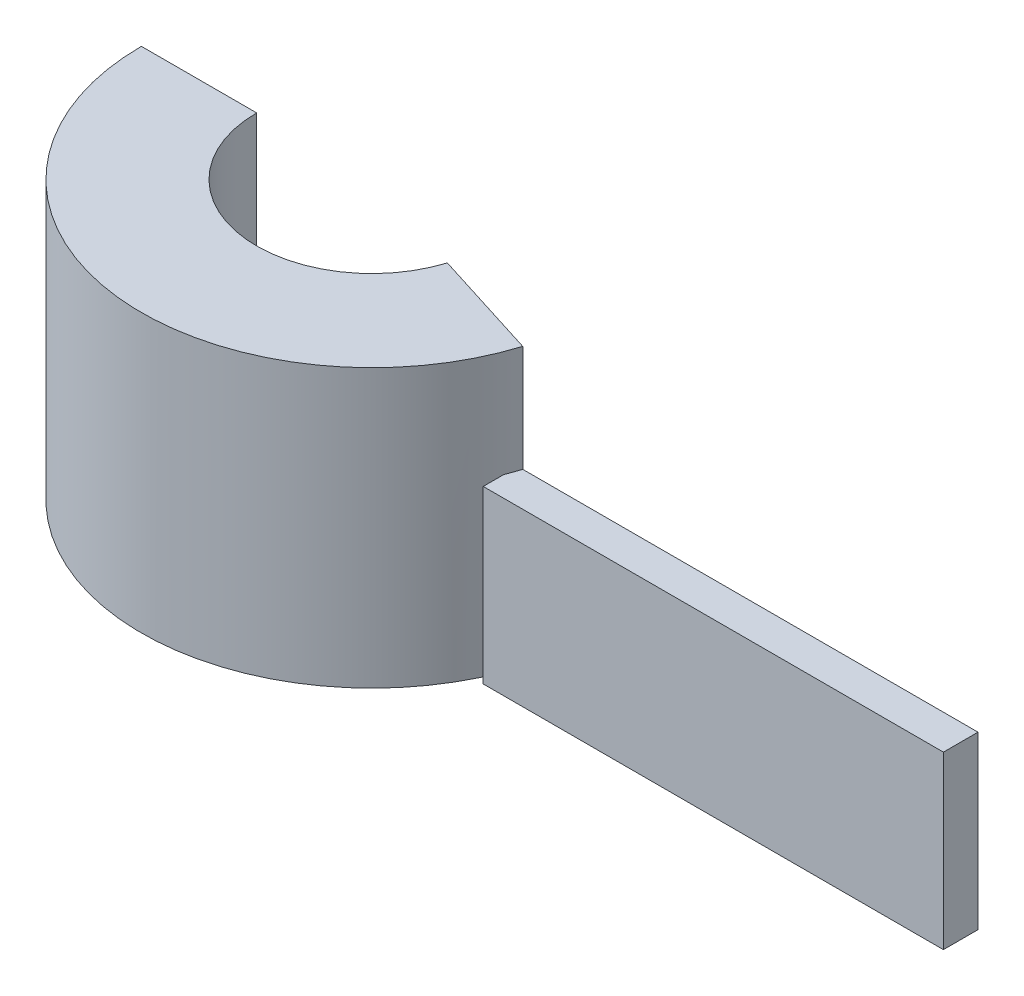
from build123d import *

# Parameters (mm, degrees)
SKETCH1_W              = 10
SKETCH1_H              = 24.07430416
REVOLVE2_ANGLE         = 180
BOSS_EXTRUDE1_START    = 6
SKETCH1_7_W            = 39.916856905
SKETCH1_7_H            = 14.839467349
BOSS_EXTRUDE1_DEPTH    = 3
CUT_REVOLVE2_START     = -19.078784028
CUT_REVOLVE2_OUTLINE_W = 24.07430416
CUT_REVOLVE2_OUTLINE_H = 7
CUT_REVOLVE2_DEPTH     = 39.078784028


with BuildPart() as part:
    # Sketch1 → Revolve2 (revolve)
    with BuildSketch(Plane.XY):
        with Locations((15, 6.197684731)):
            Rectangle(SKETCH1_W, SKETCH1_H)
    revolve(axis=Axis((0, -3.039467349, 0), (0, -1, 0)), revolution_arc=REVOLVE2_ANGLE)

    # Sketch1<7> → Boss-Extrude1 (add)
    with BuildSketch(Plane.XY.offset(BOSS_EXTRUDE1_START)):
        with Locations((38.608341788, 1.580266325)):
            Rectangle(SKETCH1_7_W, SKETCH1_7_H)
    extrude(amount=BOSS_EXTRUDE1_DEPTH)

    # Cut-Revolve2: read off the stored shape, not the designer's step
    # Cut-Revolve2 outline → Cut-Revolve2 (cut)
    with BuildSketch(Plane(origin=(0, 0, 0), x_dir=(0, 1, 0), z_dir=(0.9539392014169458, 0, 0.29999999999999993)).offset(CUT_REVOLVE2_START)):
        with Locations((6.197684731, -3.5)):
            Rectangle(CUT_REVOLVE2_OUTLINE_W, CUT_REVOLVE2_OUTLINE_H)
    extrude(amount=CUT_REVOLVE2_DEPTH, mode=Mode.SUBTRACT)


solid = part.part
